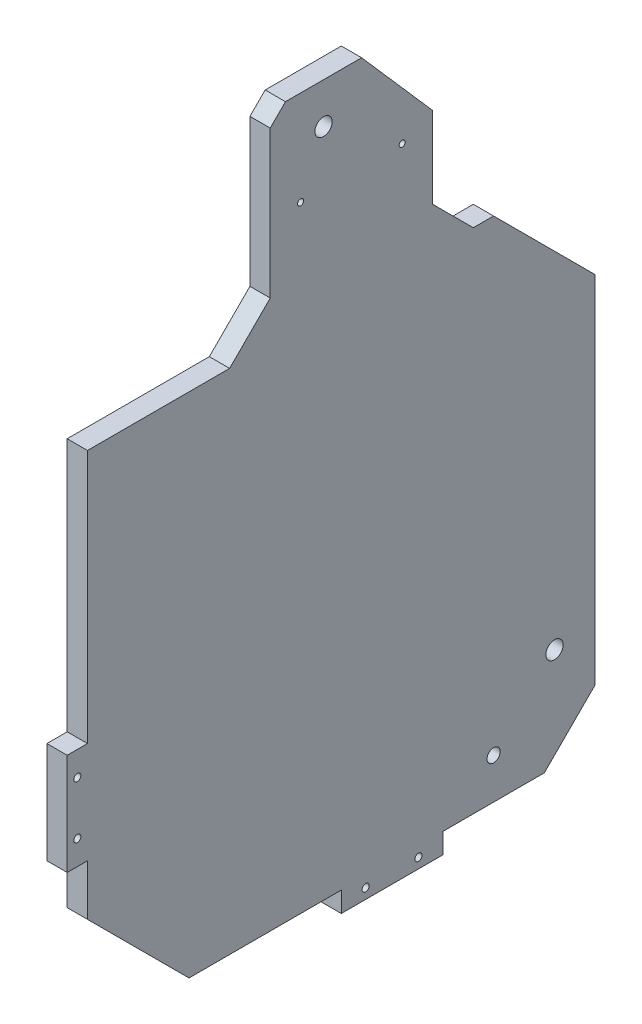
from build123d import *

# Parameters (mm, degrees)
SKETCH1_R           = 1.75
BOSS_EXTRUDE1_DEPTH = 10
SKETCH2_R           = 1.5
CUT_EXTRUDE1_DEPTH  = 15
SKETCH3_R           = 4.25
SKETCH3_R_2         = 3.25
CUT_EXTRUDE2_DEPTH  = 431.232495286
SKETCH4_R           = 1.5
CUT_EXTRUDE3_DEPTH  = 10


with BuildPart() as part:
    # Sketch1 → Boss-Extrude1 (new body)
    with BuildSketch(Plane(origin=(0, 0, 0), x_dir=(0, 0, -1), z_dir=(1, 0, 0))):
        Polygon((50, 0), (125, 0), (125, -10), (175, -10), (175, 0), (225, 0), (250, 25), (250, 200), (200, 250), (190, 250), (170, 270), (170, 310), (135, 350), (97.5, 350), (90, 342.5), (90, 270), (70, 250), (0, 250), (0, 125), (-10, 125), (-10, 75), (0, 75), (0, 50), align=None)
        with Locations((-5, 113)):
            Circle(SKETCH1_R, mode=Mode.SUBTRACT)
        with Locations((-5, 87)):
            Circle(SKETCH1_R, mode=Mode.SUBTRACT)
        with Locations((137, -5)):
            Circle(SKETCH1_R, mode=Mode.SUBTRACT)
        with Locations((163, -5)):
            Circle(SKETCH1_R, mode=Mode.SUBTRACT)
    extrude(amount=BOSS_EXTRUDE1_DEPTH)

    # Sketch2 → Cut-Extrude1 (cut)
    with BuildSketch(Plane(origin=(0, 225, -225), x_dir=(1, 0, 0), z_dir=(0, 0.7071067811865477, -0.7071067811865475))):
        with Locations((5, 4.644660941)):
            Circle(SKETCH2_R)
        with Locations((5, -25.355339059)):
            Circle(SKETCH2_R)
    extrude(amount=-CUT_EXTRUDE1_DEPTH, mode=Mode.SUBTRACT)

    # Sketch3 → Cut-Extrude2 (cut, through all)
    with BuildSketch(Plane(origin=(10, 0, 0), x_dir=(0, 0, -1), z_dir=(1, 0, 0))):
        with Locations((230, 50)):
            Circle(SKETCH3_R)
        with Locations((200, 20)):
            Circle(SKETCH3_R_2)
        with Locations((116.25, 330)):
            Circle(SKETCH3_R)
    extrude(amount=-CUT_EXTRUDE2_DEPTH, mode=Mode.SUBTRACT)

    # Sketch4 → Cut-Extrude3 (cut)
    with BuildSketch(Plane(origin=(10, 0, 0), x_dir=(0, 0, -1), z_dir=(1, 0, 0))):
        with Locations((105, 303.332113701)):
            Circle(SKETCH4_R)
        with Locations((155, 303.332113701)):
            Circle(SKETCH4_R)
    extrude(amount=-CUT_EXTRUDE3_DEPTH, mode=Mode.SUBTRACT)


solid = part.part
